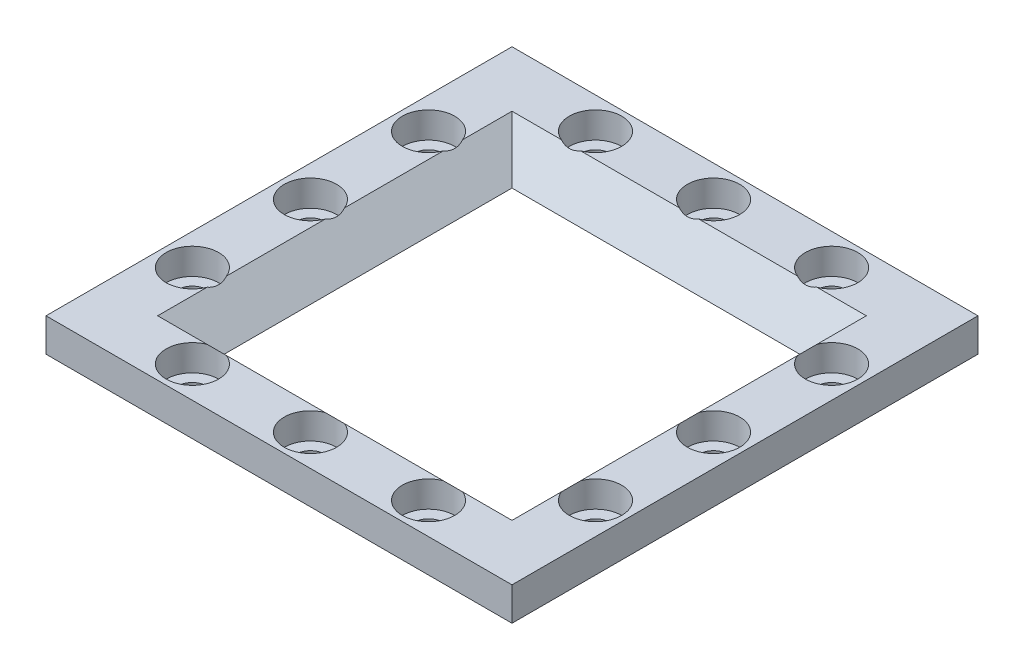
from build123d import *

# Parameters (mm, degrees)
SKETCH1_W                      = 88.9
SKETCH1_H                      = 88.9
SKETCH1_W_2                    = 54.9
SKETCH1_H_2                    = 54.9
BOSS_EXTRUDE1_DEPTH            = 6.35
CHAMFER1_SIZE                  = 6.35
CBORE_FOR_M5_SHCS3_D           = 5.5
CBORE_FOR_M5_SHCS3_CBORE_D     = 10
CBORE_FOR_M5_SHCS3_CBORE_DEPTH = 5


with BuildPart() as part:
    # Sketch1 → Boss-Extrude1 (new body)
    with BuildSketch(Plane(origin=(0, 0, 0), x_dir=(1, 0, 0), z_dir=(0, 1, 0))):
        Rectangle(SKETCH1_W, SKETCH1_H)
        Rectangle(SKETCH1_W_2, SKETCH1_H_2, mode=Mode.SUBTRACT)
    extrude(amount=BOSS_EXTRUDE1_DEPTH)

    # Chamfer1
    chamfer1_edges = [part.edges().sort_by_distance(p)[0] for p in [
        (0, 6.35, 27.45),
        (27.45, 6.35, 0),
        (-27.45, 6.35, 0),
        (0, 6.35, -27.45),
    ]]
    chamfer(chamfer1_edges, length=CHAMFER1_SIZE - 0.0001)  # a hair under: the kernel refuses the full size

    # CBORE for M5 SHCS3 (through all)
    with Locations(Plane(origin=(0, 6.35, 0), x_dir=(1, 0, 0), z_dir=(0, 1, 0))):
        with Locations((-22.523488527, 38.45), (0, 38.45), (22.523488527, 38.45), (38.45, 22.523488527), (38.45, 0), (38.45, -22.523488527), (22.523488527, -38.45), (0, -38.45), (-22.523488527, -38.45), (-38.45, -22.523488527), (-38.45, 0), (-38.45, 22.523488527)):
            CounterBoreHole(CBORE_FOR_M5_SHCS3_D / 2, CBORE_FOR_M5_SHCS3_CBORE_D / 2, CBORE_FOR_M5_SHCS3_CBORE_DEPTH)


solid = part.part
